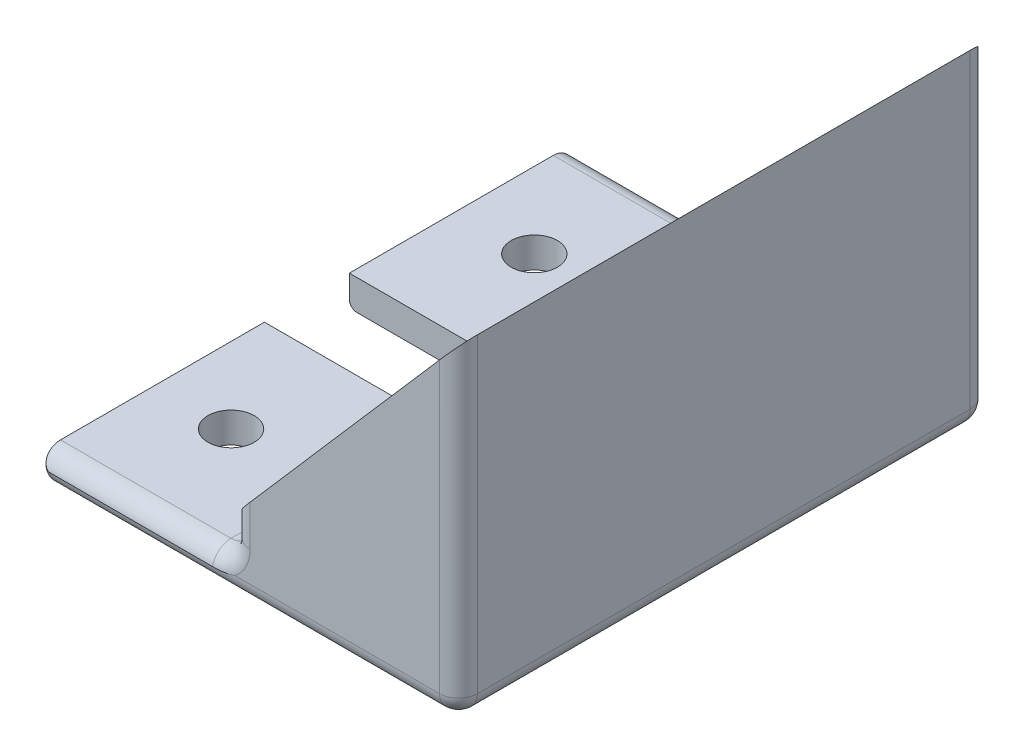
from build123d import *

# Parameters (mm, degrees)
BOSS_EXTRUDE1_DEPTH = 35
SKETCH3_W           = 11.2
SKETCH3_H           = 6
CUT_EXTRUDE1_DEPTH  = 58.584830686
SKETCH4_R           = 3.05
CUT_EXTRUDE2_DEPTH  = 61.713451947
FILLET1_R           = 2.5
FILLET4_R           = 1


# Some blends are built 0.0001 mm under size
with BuildPart() as part:
    # Sketch2 → Boss-Extrude1 (new, symmetric)
    with BuildSketch(Plane.XY):
        Polygon((0, 0), (30, 34.511052217), (30, -9), (-25, -9), (-25, -5), (0, -5), align=None)
    extrude(amount=BOSS_EXTRUDE1_DEPTH, both=True)

    # Sketch3 → Cut-Extrude1 (cut, through all)
    with BuildSketch(Plane(origin=(0, 0, 0), x_dir=(0, 0, -1), z_dir=(1, 0, 0))):
        with Locations((0, -6)):
            Rectangle(SKETCH3_W, SKETCH3_H)
    extrude(amount=-CUT_EXTRUDE1_DEPTH, mode=Mode.SUBTRACT)

    # Sketch4 → Cut-Extrude2 (cut, through all)
    with BuildSketch(Plane(origin=(0, -5, 0), x_dir=(1, 0, 0), z_dir=(0, 1, 0))):
        with Locations(Location((-15, -20, 0), (0, 0, 270))):
            Circle(SKETCH4_R)
        with Locations(Location((-15, 20, 0), (0, 0, 90))):
            Circle(SKETCH4_R)
    extrude(amount=-CUT_EXTRUDE2_DEPTH, mode=Mode.SUBTRACT)

    # Fillet1
    # the kernel refuses this fillet: 2.5 mm, written as the material it adds along each edge
    with BuildSketch(Plane(origin=(0, -5, -35), x_dir=(0, 1, 0), z_dir=(0, 0, 1)), Plane(origin=(0, -5, 5.6), x_dir=(0, 1, 0), z_dir=(0, 0, 1))) as fillet1_piece_1:
        with BuildLine():
            CenterArc((FILLET1_R, FILLET1_R), FILLET1_R, 180, 90)
            Line((0, FILLET1_R), (0, 0))
            Line((0, 0), (FILLET1_R, 0))
        make_face()
    extrude(amount=29.4)
    # the kernel refuses this fillet: 2.5 mm, written as the material it takes off along each edge
    with BuildSketch(Plane(origin=(27.5, -6.5, 32.5), x_dir=(1, 0, 0), z_dir=(0, 0, 1))) as fillet1_2_piece_1_section:
        Polygon((0, 0), (FILLET1_R, 0), (FILLET1_R, -FILLET1_R), (0, -FILLET1_R), align=None)
    fillet1_2_piece_1 = extrude(amount=FILLET1_R, mode=Mode.PRIVATE)
    fillet1_2_piece_1 = fillet1_2_piece_1 - Plane(origin=(27.5, -6.5, 32.5), x_dir=(-0.7071067811865476, 0.7071067811865474, 0), z_dir=(0, 0, 1)) * Sphere(FILLET1_R, mode=Mode.PRIVATE)
    add(fillet1_2_piece_1, mode=Mode.SUBTRACT)
    with BuildSketch(Plane(origin=(27.5, -6.5, -32.5), x_dir=(0, 0, -1), z_dir=(1, 0, 0))) as fillet1_2_piece_2_section:
        Polygon((0, 0), (FILLET1_R, 0), (FILLET1_R, -FILLET1_R), (0, -FILLET1_R), align=None)
    fillet1_2_piece_2 = extrude(amount=FILLET1_R, mode=Mode.PRIVATE)
    fillet1_2_piece_2 = fillet1_2_piece_2 - Plane(origin=(27.5, -6.5, -32.5), x_dir=(0, 0.7071067811865475, 0.7071067811865475), z_dir=(1, 0, 0)) * Sphere(FILLET1_R, mode=Mode.PRIVATE)
    add(fillet1_2_piece_2, mode=Mode.SUBTRACT)
    with BuildSketch(Plane(origin=(30, -9, 32.5), x_dir=(-1, 0, 0), z_dir=(0, 0, -1))) as fillet1_2_piece_3:
        with BuildLine():
            CenterArc((FILLET1_R, FILLET1_R), FILLET1_R, 180, 90)
            Line((0, FILLET1_R), (0, 0))
            Line((0, 0), (FILLET1_R, 0))
        make_face()
    extrude(amount=65, mode=Mode.SUBTRACT)
    with BuildSketch(Plane(origin=(30, 40.761052217, -35), x_dir=(0, 0, 1), z_dir=(0, -1, 0)), Plane(origin=(30, 40.761052217, 35), x_dir=(-1, 0, 0), z_dir=(0, -1, 0))) as fillet1_2_piece_4:
        with BuildLine():
            CenterArc((FILLET1_R, FILLET1_R), FILLET1_R, 180, 90)
            Line((0, FILLET1_R), (0, 0))
            Line((0, 0), (FILLET1_R, 0))
        make_face()
    extrude(amount=47.261052217, mode=Mode.SUBTRACT)
    with BuildSketch(Plane(origin=(27.5, -9, 35), x_dir=(0, 1, 0), z_dir=(-1, 0, 0)), Plane(origin=(27.5, -9, -35), x_dir=(0, 0, 1), z_dir=(-1, 0, 0))) as fillet1_2_piece_5:
        with BuildLine():
            CenterArc((FILLET1_R, FILLET1_R), FILLET1_R, 180, 90)
            Line((0, FILLET1_R), (0, 0))
            Line((0, 0), (FILLET1_R, 0))
        make_face()
    extrude(amount=58.75, mode=Mode.SUBTRACT)
    # the kernel refuses this fillet: 2.5 mm, written as the material it takes off along each edge
    with BuildSketch(Plane(origin=(0, -2.5, 35), x_dir=(0, 0, -1), z_dir=(0, 1, 0))) as fillet1_3_piece_1:
        with BuildLine():
            CenterArc((FILLET1_R, -FILLET1_R), FILLET1_R, 90, 90)
            Line((0, -FILLET1_R), (0, 0))
            Line((0, 0), (FILLET1_R, 0))
        make_face()
    extrude(amount=8.75, mode=Mode.SUBTRACT)
    with BuildSketch(Plane(origin=(0, -2.5, -35), x_dir=(0, 0, 1), z_dir=(0, 1, 0))) as fillet1_3_piece_2:
        with BuildLine():
            CenterArc((FILLET1_R, FILLET1_R), FILLET1_R, 180, 90)
            Line((0, FILLET1_R), (0, 0))
            Line((0, 0), (FILLET1_R, 0))
        make_face()
    extrude(amount=8.75, mode=Mode.SUBTRACT)
    with BuildSketch(Plane(origin=(-31.25, -5, 35), x_dir=(0, -1, 0), z_dir=(1, 0, 0))) as fillet1_3_piece_3:
        with BuildLine():
            CenterArc((FILLET1_R, FILLET1_R), FILLET1_R, 180, 90)
            Line((0, FILLET1_R), (0, 0))
            Line((0, 0), (FILLET1_R, 0))
        make_face()
    extrude(amount=28.75, mode=Mode.SUBTRACT)
    with BuildSketch(Plane(origin=(-31.25, -5, -35), x_dir=(0, -1, 0), z_dir=(1, 0, 0))) as fillet1_3_piece_4:
        with BuildLine():
            CenterArc((FILLET1_R, -FILLET1_R), FILLET1_R, 90, 90)
            Line((0, -FILLET1_R), (0, 0))
            Line((0, 0), (FILLET1_R, 0))
        make_face()
    extrude(amount=28.75, mode=Mode.SUBTRACT)
    with BuildSketch(Plane(origin=(-2.5, -2.5, -35), x_dir=(1, 0, 0), z_dir=(0, 1, 0))) as fillet1_3_piece_5:
        with BuildLine():
            CenterArc((2.5 + FILLET1_R, -FILLET1_R), FILLET1_R, 90, 90)
            Line((2.5, -FILLET1_R), (2.5, 0))
            Line((2.5, 0), (2.5 + FILLET1_R, 0))
        make_face()
    revolve(axis=Axis((-2.5, -2.5, -35), (0, 0, -1)), revolution_arc=90, mode=Mode.SUBTRACT)
    with BuildSketch(Plane(origin=(-2.5, -2.5, 35), x_dir=(1, 0, 0), z_dir=(0, 1, 0))) as fillet1_3_piece_6:
        with BuildLine():
            CenterArc((2.5 + FILLET1_R, FILLET1_R), FILLET1_R, 180, 90)
            Line((2.5, FILLET1_R), (2.5, 0))
            Line((2.5, 0), (2.5 + FILLET1_R, 0))
        make_face()
    revolve(axis=Axis((-2.5, -2.5, 35), (0, 0, -1)), revolution_arc=90, mode=Mode.SUBTRACT)

    # Fillet4
    fillet4_edges = [part.edges().sort_by_distance(p)[0] for p in [
        (-25, -8.436491673, -34.08113883),
        (-25, -8.436491673, 34.08113883),
        (-25, -9, -19.05),
        (-25, -9, 19.05),
    ]]
    fillet(fillet4_edges, radius=FILLET4_R - 0.0001)  # a hair under: the kernel refuses the full size


solid = part.part
